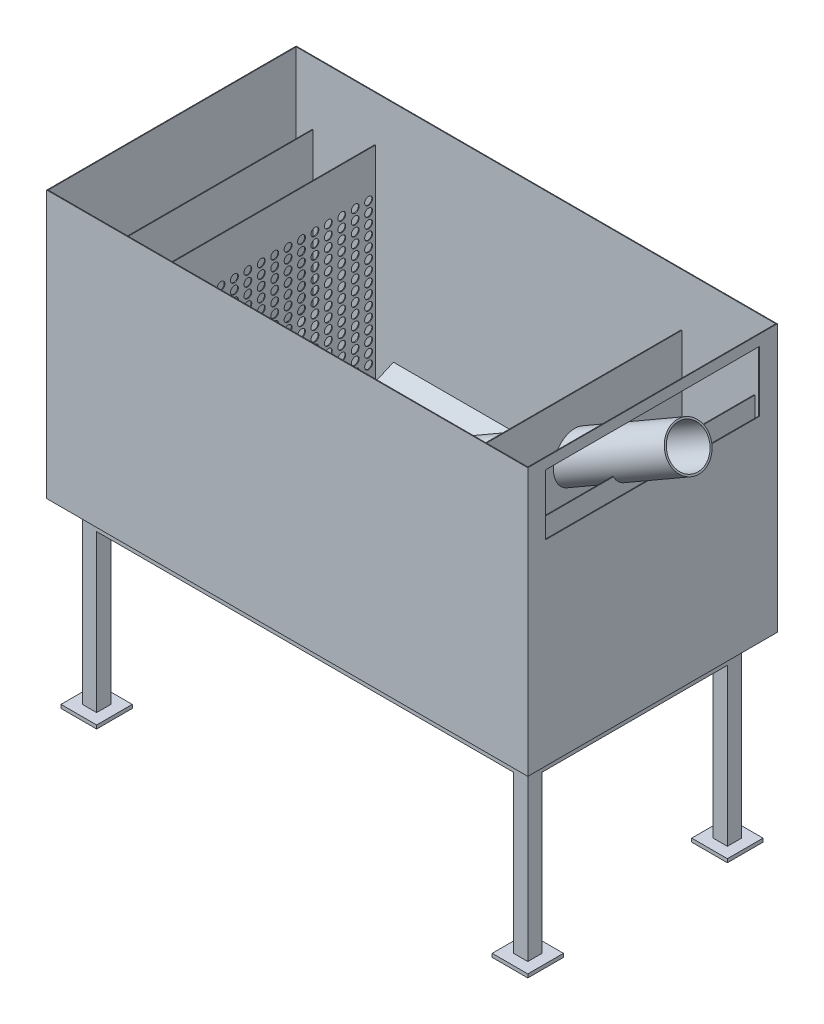
from build123d import *

# Parameters (mm, degrees)
MASTER_FOOTPRINT_W                    = 1350
MASTER_FOOTPRINT_H                    = 700
BATH_BASE_PLATE_DEPTH                 = 750
BATH_SHELL_2MM_T                      = -2
SKETCH_1_R                            = 50
INLET_D100_OPENING_DEPTH              = 10
INLET_IMPACT_BAFFLE_START             = 125
SKETCH_2_W                            = 540
SKETCH_2_H                            = 430
INLET_IMPACT_BAFFLE_DEPTH             = 2
DISTRIBUTOR_D22_START                 = 250
SKETCH_3_W                            = 640
SKETCH_3_H                            = 648
SKETCH_3_R                            = 11
DISTRIBUTOR_D22_DEPTH                 = 2
OUTLET_SUBMERGED_BAFFLE_START         = 1130
SKETCH_4_W                            = 600
SKETCH_4_H                            = 330
OUTLET_SUBMERGED_BAFFLE_DEPTH         = 2
OVERFLOW_WEIR_Z550_START              = 1290
SKETCH_5_W                            = 690
SKETCH_5_H                            = 548
OVERFLOW_WEIR_Z550_DEPTH              = 2
OUTLET_WEIR_SLOT_W600_START           = 1345
SKETCH_6_W                            = 600
SKETCH_6_H                            = 170
OUTLET_WEIR_SLOT_W600_DEPTH           = 10
SLOPED_SEDIMENT_FLOOR_START           = 275
SLOPED_SEDIMENT_FLOOR_DEPTH           = 825
SKETCH_8_W                            = 40
SKETCH_8_H                            = 40
FRAME_LEGS_40X40_H500_DEPTH           = 500
FRAME_LONGITUDINAL_RAILS_START        = -20
SKETCH_9_W                            = 1250
SKETCH_9_H                            = 40
FRAME_LONGITUDINAL_RAILS_DEPTH        = 40
FRAME_TRANSVERSE_RAILS_START          = -20
SKETCH_10_W                           = 40
SKETCH_10_H                           = 520
FRAME_TRANSVERSE_RAILS_DEPTH          = 40
FRAME_FOOT_PADS_100X100_START         = -500
SKETCH_11_W                           = 100
SKETCH_11_H                           = 100
FRAME_FOOT_PADS_100X100_DEPTH         = 10
SEALED_SCREW_PASSAGE_D120_PROFILE_R   = 60
SCREW_CASING_THIN_D110_T5_PROFILE_R   = 60
SCREW_CASING_THIN_D110_T5_PROFILE_R_2 = 55


with BuildPart() as part:
    # MASTER_FOOTPRINT → BATH_BASE_PLATE (new body)
    with BuildSketch(Plane(origin=(0, 0, 0), x_dir=(1, 0, 0), z_dir=(0, 1, 0))):
        with Locations((675, 350)):
            Rectangle(MASTER_FOOTPRINT_W, MASTER_FOOTPRINT_H)
    extrude(amount=BATH_BASE_PLATE_DEPTH)

    # BATH_SHELL_2MM
    bath_shell_2mm_openings = [part.faces().sort_by_distance(p)[0] for p in [
        (675, 750, -350),
    ]]
    offset(amount=BATH_SHELL_2MM_T, openings=bath_shell_2mm_openings, kind=Kind.INTERSECTION)

    # Эскиз1 → INLET_D100_OPENING (cut)
    with BuildSketch(Plane(origin=(0, 0, 0), x_dir=(0, 0, -1), z_dir=(1, 0, 0))):
        with Locations((350, 420)):
            Circle(SKETCH_1_R)
    extrude(amount=INLET_D100_OPENING_DEPTH, mode=Mode.SUBTRACT)

    # Эскиз6 → OUTLET_WEIR_SLOT_W600 (cut)
    with BuildSketch(Plane(origin=(0, 0, 0), x_dir=(0, 0, -1), z_dir=(1, 0, 0)).offset(OUTLET_WEIR_SLOT_W600_START)):
        with Locations((350, 635)):
            Rectangle(SKETCH_6_W, SKETCH_6_H)
    extrude(amount=OUTLET_WEIR_SLOT_W600_DEPTH, mode=Mode.SUBTRACT)

    # Эскиз7 → SLOPED_SEDIMENT_FLOOR (add)
    with BuildSketch(Plane(origin=(0, 0, 0), x_dir=(0, 0, -1), z_dir=(1, 0, 0)).offset(SLOPED_SEDIMENT_FLOOR_START)):
        Polygon((2, -1), (2, 120), (280, -1), align=None)
        Polygon((698, -1), (698, 120), (420, -1), align=None)
    extrude(amount=SLOPED_SEDIMENT_FLOOR_DEPTH)

    # Эскиз8 → FRAME_LEGS_40X40_H500 (add)
    with BuildSketch(Plane(origin=(0, 0, 0), x_dir=(1, 0, 0), z_dir=(0, 1, 0))):
        with Locations((70, 70)):
            Rectangle(SKETCH_8_W, SKETCH_8_H)
        with Locations((70, 630)):
            Rectangle(SKETCH_8_W, SKETCH_8_H)
        with Locations((1280, 70)):
            Rectangle(SKETCH_8_W, SKETCH_8_H)
        with Locations((1280, 630)):
            Rectangle(SKETCH_8_W, SKETCH_8_H)
    extrude(amount=-FRAME_LEGS_40X40_H500_DEPTH)

    # Эскиз9 → FRAME_LONGITUDINAL_RAILS (add)
    with BuildSketch(Plane(origin=(0, 0, 0), x_dir=(1, 0, 0), z_dir=(0, 1, 0)).offset(FRAME_LONGITUDINAL_RAILS_START)):
        with Locations((675, 70)):
            Rectangle(SKETCH_9_W, SKETCH_9_H)
        with Locations((675, 630)):
            Rectangle(SKETCH_9_W, SKETCH_9_H)
    extrude(amount=-FRAME_LONGITUDINAL_RAILS_DEPTH)

    # Эскиз10 → FRAME_TRANSVERSE_RAILS (add)
    with BuildSketch(Plane(origin=(0, 0, 0), x_dir=(1, 0, 0), z_dir=(0, 1, 0)).offset(FRAME_TRANSVERSE_RAILS_START)):
        with Locations((70, 350)):
            Rectangle(SKETCH_10_W, SKETCH_10_H)
        with Locations((1280, 350)):
            Rectangle(SKETCH_10_W, SKETCH_10_H)
    extrude(amount=-FRAME_TRANSVERSE_RAILS_DEPTH)

    # Эскиз11 → FRAME_FOOT_PADS_100X100 (add)
    with BuildSketch(Plane(origin=(0, 0, 0), x_dir=(1, 0, 0), z_dir=(0, 1, 0)).offset(FRAME_FOOT_PADS_100X100_START)):
        with Locations((70, 70)):
            Rectangle(SKETCH_11_W, SKETCH_11_H)
        with Locations((70, 630)):
            Rectangle(SKETCH_11_W, SKETCH_11_H)
        with Locations((1280, 70)):
            Rectangle(SKETCH_11_W, SKETCH_11_H)
        with Locations((1280, 630)):
            Rectangle(SKETCH_11_W, SKETCH_11_H)
    extrude(amount=-FRAME_FOOT_PADS_100X100_DEPTH)


with BuildPart() as body_2:
    # Эскиз2 → INLET_IMPACT_BAFFLE (new body)
    with BuildSketch(Plane(origin=(0, 0, 0), x_dir=(0, 0, -1), z_dir=(1, 0, 0)).offset(INLET_IMPACT_BAFFLE_START)):
        with Locations((350, 435)):
            Rectangle(SKETCH_2_W, SKETCH_2_H)
    extrude(amount=INLET_IMPACT_BAFFLE_DEPTH)


with BuildPart() as body_3:
    # Эскиз3 → DISTRIBUTOR_D22 (new body)
    with BuildSketch(Plane(origin=(0, 0, 0), x_dir=(0, 0, -1), z_dir=(1, 0, 0)).offset(DISTRIBUTOR_D22_START)):
        with Locations((350, 326)):
            Rectangle(SKETCH_3_W, SKETCH_3_H)
        with Locations((48.823529412, 125)):
            Circle(SKETCH_3_R, mode=Mode.SUBTRACT)
        with Locations((48.823529412, 153.5)):
            Circle(SKETCH_3_R, mode=Mode.SUBTRACT)
        with Locations((48.823529412, 182)):
            Circle(SKETCH_3_R, mode=Mode.SUBTRACT)
        with Locations((48.823529412, 210.5)):
            Circle(SKETCH_3_R, mode=Mode.SUBTRACT)
        with Locations((48.823529412, 239)):
            Circle(SKETCH_3_R, mode=Mode.SUBTRACT)
        with Locations((48.823529412, 267.5)):
            Circle(SKETCH_3_R, mode=Mode.SUBTRACT)
        with Locations((48.823529412, 296)):
            Circle(SKETCH_3_R, mode=Mode.SUBTRACT)
        with Locations((48.823529412, 324.5)):
            Circle(SKETCH_3_R, mode=Mode.SUBTRACT)
        with Locations((48.823529412, 353)):
            Circle(SKETCH_3_R, mode=Mode.SUBTRACT)
        with Locations((48.823529412, 381.5)):
            Circle(SKETCH_3_R, mode=Mode.SUBTRACT)
        with Locations((48.823529412, 410)):
            Circle(SKETCH_3_R, mode=Mode.SUBTRACT)
        with Locations((48.823529412, 438.5)):
            Circle(SKETCH_3_R, mode=Mode.SUBTRACT)
        with Locations((48.823529412, 467)):
            Circle(SKETCH_3_R, mode=Mode.SUBTRACT)
        with Locations((48.823529412, 495.5)):
            Circle(SKETCH_3_R, mode=Mode.SUBTRACT)
        with Locations((48.823529412, 524)):
            Circle(SKETCH_3_R, mode=Mode.SUBTRACT)
        with Locations((86.470588235, 125)):
            Circle(SKETCH_3_R, mode=Mode.SUBTRACT)
        with Locations((86.470588235, 153.5)):
            Circle(SKETCH_3_R, mode=Mode.SUBTRACT)
        with Locations((86.470588235, 182)):
            Circle(SKETCH_3_R, mode=Mode.SUBTRACT)
        with Locations((86.470588235, 210.5)):
            Circle(SKETCH_3_R, mode=Mode.SUBTRACT)
        with Locations((86.470588235, 239)):
            Circle(SKETCH_3_R, mode=Mode.SUBTRACT)
        with Locations((86.470588235, 267.5)):
            Circle(SKETCH_3_R, mode=Mode.SUBTRACT)
        with Locations((86.470588235, 296)):
            Circle(SKETCH_3_R, mode=Mode.SUBTRACT)
        with Locations((86.470588235, 324.5)):
            Circle(SKETCH_3_R, mode=Mode.SUBTRACT)
        with Locations((86.470588235, 353)):
            Circle(SKETCH_3_R, mode=Mode.SUBTRACT)
        with Locations((86.470588235, 381.5)):
            Circle(SKETCH_3_R, mode=Mode.SUBTRACT)
        with Locations((86.470588235, 410)):
            Circle(SKETCH_3_R, mode=Mode.SUBTRACT)
        with Locations((86.470588235, 438.5)):
            Circle(SKETCH_3_R, mode=Mode.SUBTRACT)
        with Locations((86.470588235, 467)):
            Circle(SKETCH_3_R, mode=Mode.SUBTRACT)
        with Locations((86.470588235, 495.5)):
            Circle(SKETCH_3_R, mode=Mode.SUBTRACT)
        with Locations((86.470588235, 524)):
            Circle(SKETCH_3_R, mode=Mode.SUBTRACT)
        with Locations((124.117647059, 125)):
            Circle(SKETCH_3_R, mode=Mode.SUBTRACT)
        with Locations((124.117647059, 153.5)):
            Circle(SKETCH_3_R, mode=Mode.SUBTRACT)
        with Locations((124.117647059, 182)):
            Circle(SKETCH_3_R, mode=Mode.SUBTRACT)
        with Locations((124.117647059, 210.5)):
            Circle(SKETCH_3_R, mode=Mode.SUBTRACT)
        with Locations((124.117647059, 239)):
            Circle(SKETCH_3_R, mode=Mode.SUBTRACT)
        with Locations((124.117647059, 267.5)):
            Circle(SKETCH_3_R, mode=Mode.SUBTRACT)
        with Locations((124.117647059, 296)):
            Circle(SKETCH_3_R, mode=Mode.SUBTRACT)
        with Locations((124.117647059, 324.5)):
            Circle(SKETCH_3_R, mode=Mode.SUBTRACT)
        with Locations((124.117647059, 353)):
            Circle(SKETCH_3_R, mode=Mode.SUBTRACT)
        with Locations((124.117647059, 381.5)):
            Circle(SKETCH_3_R, mode=Mode.SUBTRACT)
        with Locations((124.117647059, 410)):
            Circle(SKETCH_3_R, mode=Mode.SUBTRACT)
        with Locations((124.117647059, 438.5)):
            Circle(SKETCH_3_R, mode=Mode.SUBTRACT)
        with Locations((124.117647059, 467)):
            Circle(SKETCH_3_R, mode=Mode.SUBTRACT)
        with Locations((124.117647059, 495.5)):
            Circle(SKETCH_3_R, mode=Mode.SUBTRACT)
        with Locations((124.117647059, 524)):
            Circle(SKETCH_3_R, mode=Mode.SUBTRACT)
        with Locations((161.764705882, 125)):
            Circle(SKETCH_3_R, mode=Mode.SUBTRACT)
        with Locations((161.764705882, 153.5)):
            Circle(SKETCH_3_R, mode=Mode.SUBTRACT)
        with Locations((161.764705882, 182)):
            Circle(SKETCH_3_R, mode=Mode.SUBTRACT)
        with Locations((161.764705882, 210.5)):
            Circle(SKETCH_3_R, mode=Mode.SUBTRACT)
        with Locations((161.764705882, 239)):
            Circle(SKETCH_3_R, mode=Mode.SUBTRACT)
        with Locations((161.764705882, 267.5)):
            Circle(SKETCH_3_R, mode=Mode.SUBTRACT)
        with Locations((161.764705882, 296)):
            Circle(SKETCH_3_R, mode=Mode.SUBTRACT)
        with Locations((161.764705882, 324.5)):
            Circle(SKETCH_3_R, mode=Mode.SUBTRACT)
        with Locations((161.764705882, 353)):
            Circle(SKETCH_3_R, mode=Mode.SUBTRACT)
        with Locations((161.764705882, 381.5)):
            Circle(SKETCH_3_R, mode=Mode.SUBTRACT)
        with Locations((161.764705882, 410)):
            Circle(SKETCH_3_R, mode=Mode.SUBTRACT)
        with Locations((161.764705882, 438.5)):
            Circle(SKETCH_3_R, mode=Mode.SUBTRACT)
        with Locations((161.764705882, 467)):
            Circle(SKETCH_3_R, mode=Mode.SUBTRACT)
        with Locations((161.764705882, 495.5)):
            Circle(SKETCH_3_R, mode=Mode.SUBTRACT)
        with Locations((161.764705882, 524)):
            Circle(SKETCH_3_R, mode=Mode.SUBTRACT)
        with Locations((199.411764706, 125)):
            Circle(SKETCH_3_R, mode=Mode.SUBTRACT)
        with Locations((199.411764706, 153.5)):
            Circle(SKETCH_3_R, mode=Mode.SUBTRACT)
        with Locations((199.411764706, 182)):
            Circle(SKETCH_3_R, mode=Mode.SUBTRACT)
        with Locations((199.411764706, 210.5)):
            Circle(SKETCH_3_R, mode=Mode.SUBTRACT)
        with Locations((199.411764706, 239)):
            Circle(SKETCH_3_R, mode=Mode.SUBTRACT)
        with Locations((199.411764706, 267.5)):
            Circle(SKETCH_3_R, mode=Mode.SUBTRACT)
        with Locations((199.411764706, 296)):
            Circle(SKETCH_3_R, mode=Mode.SUBTRACT)
        with Locations((199.411764706, 324.5)):
            Circle(SKETCH_3_R, mode=Mode.SUBTRACT)
        with Locations((199.411764706, 353)):
            Circle(SKETCH_3_R, mode=Mode.SUBTRACT)
        with Locations((199.411764706, 381.5)):
            Circle(SKETCH_3_R, mode=Mode.SUBTRACT)
        with Locations((199.411764706, 410)):
            Circle(SKETCH_3_R, mode=Mode.SUBTRACT)
        with Locations((199.411764706, 438.5)):
            Circle(SKETCH_3_R, mode=Mode.SUBTRACT)
        with Locations((199.411764706, 467)):
            Circle(SKETCH_3_R, mode=Mode.SUBTRACT)
        with Locations((199.411764706, 495.5)):
            Circle(SKETCH_3_R, mode=Mode.SUBTRACT)
        with Locations((199.411764706, 524)):
            Circle(SKETCH_3_R, mode=Mode.SUBTRACT)
        with Locations((237.058823529, 125)):
            Circle(SKETCH_3_R, mode=Mode.SUBTRACT)
        with Locations((237.058823529, 153.5)):
            Circle(SKETCH_3_R, mode=Mode.SUBTRACT)
        with Locations((237.058823529, 182)):
            Circle(SKETCH_3_R, mode=Mode.SUBTRACT)
        with Locations((237.058823529, 210.5)):
            Circle(SKETCH_3_R, mode=Mode.SUBTRACT)
        with Locations((237.058823529, 239)):
            Circle(SKETCH_3_R, mode=Mode.SUBTRACT)
        with Locations((237.058823529, 267.5)):
            Circle(SKETCH_3_R, mode=Mode.SUBTRACT)
        with Locations((237.058823529, 296)):
            Circle(SKETCH_3_R, mode=Mode.SUBTRACT)
        with Locations((237.058823529, 324.5)):
            Circle(SKETCH_3_R, mode=Mode.SUBTRACT)
        with Locations((237.058823529, 353)):
            Circle(SKETCH_3_R, mode=Mode.SUBTRACT)
        with Locations((237.058823529, 381.5)):
            Circle(SKETCH_3_R, mode=Mode.SUBTRACT)
        with Locations((237.058823529, 410)):
            Circle(SKETCH_3_R, mode=Mode.SUBTRACT)
        with Locations((237.058823529, 438.5)):
            Circle(SKETCH_3_R, mode=Mode.SUBTRACT)
        with Locations((237.058823529, 467)):
            Circle(SKETCH_3_R, mode=Mode.SUBTRACT)
        with Locations((237.058823529, 495.5)):
            Circle(SKETCH_3_R, mode=Mode.SUBTRACT)
        with Locations((237.058823529, 524)):
            Circle(SKETCH_3_R, mode=Mode.SUBTRACT)
        with Locations((274.705882353, 125)):
            Circle(SKETCH_3_R, mode=Mode.SUBTRACT)
        with Locations((274.705882353, 153.5)):
            Circle(SKETCH_3_R, mode=Mode.SUBTRACT)
        with Locations((274.705882353, 182)):
            Circle(SKETCH_3_R, mode=Mode.SUBTRACT)
        with Locations((274.705882353, 210.5)):
            Circle(SKETCH_3_R, mode=Mode.SUBTRACT)
        with Locations((274.705882353, 239)):
            Circle(SKETCH_3_R, mode=Mode.SUBTRACT)
        with Locations((274.705882353, 267.5)):
            Circle(SKETCH_3_R, mode=Mode.SUBTRACT)
        with Locations((274.705882353, 296)):
            Circle(SKETCH_3_R, mode=Mode.SUBTRACT)
        with Locations((274.705882353, 324.5)):
            Circle(SKETCH_3_R, mode=Mode.SUBTRACT)
        with Locations((274.705882353, 353)):
            Circle(SKETCH_3_R, mode=Mode.SUBTRACT)
        with Locations((274.705882353, 381.5)):
            Circle(SKETCH_3_R, mode=Mode.SUBTRACT)
        with Locations((274.705882353, 410)):
            Circle(SKETCH_3_R, mode=Mode.SUBTRACT)
        with Locations((274.705882353, 438.5)):
            Circle(SKETCH_3_R, mode=Mode.SUBTRACT)
        with Locations((274.705882353, 467)):
            Circle(SKETCH_3_R, mode=Mode.SUBTRACT)
        with Locations((274.705882353, 495.5)):
            Circle(SKETCH_3_R, mode=Mode.SUBTRACT)
        with Locations((274.705882353, 524)):
            Circle(SKETCH_3_R, mode=Mode.SUBTRACT)
        with Locations((312.352941176, 125)):
            Circle(SKETCH_3_R, mode=Mode.SUBTRACT)
        with Locations((312.352941176, 153.5)):
            Circle(SKETCH_3_R, mode=Mode.SUBTRACT)
        with Locations((312.352941176, 182)):
            Circle(SKETCH_3_R, mode=Mode.SUBTRACT)
        with Locations((312.352941176, 210.5)):
            Circle(SKETCH_3_R, mode=Mode.SUBTRACT)
        with Locations((312.352941176, 239)):
            Circle(SKETCH_3_R, mode=Mode.SUBTRACT)
        with Locations((312.352941176, 267.5)):
            Circle(SKETCH_3_R, mode=Mode.SUBTRACT)
        with Locations((312.352941176, 296)):
            Circle(SKETCH_3_R, mode=Mode.SUBTRACT)
        with Locations((312.352941176, 324.5)):
            Circle(SKETCH_3_R, mode=Mode.SUBTRACT)
        with Locations((312.352941176, 353)):
            Circle(SKETCH_3_R, mode=Mode.SUBTRACT)
        with Locations((312.352941176, 381.5)):
            Circle(SKETCH_3_R, mode=Mode.SUBTRACT)
        with Locations((312.352941176, 410)):
            Circle(SKETCH_3_R, mode=Mode.SUBTRACT)
        with Locations((312.352941176, 438.5)):
            Circle(SKETCH_3_R, mode=Mode.SUBTRACT)
        with Locations((312.352941176, 467)):
            Circle(SKETCH_3_R, mode=Mode.SUBTRACT)
        with Locations((312.352941176, 495.5)):
            Circle(SKETCH_3_R, mode=Mode.SUBTRACT)
        with Locations((312.352941176, 524)):
            Circle(SKETCH_3_R, mode=Mode.SUBTRACT)
        with Locations((350, 125)):
            Circle(SKETCH_3_R, mode=Mode.SUBTRACT)
        with Locations((350, 153.5)):
            Circle(SKETCH_3_R, mode=Mode.SUBTRACT)
        with Locations((350, 182)):
            Circle(SKETCH_3_R, mode=Mode.SUBTRACT)
        with Locations((350, 210.5)):
            Circle(SKETCH_3_R, mode=Mode.SUBTRACT)
        with Locations((350, 239)):
            Circle(SKETCH_3_R, mode=Mode.SUBTRACT)
        with Locations((350, 267.5)):
            Circle(SKETCH_3_R, mode=Mode.SUBTRACT)
        with Locations((350, 296)):
            Circle(SKETCH_3_R, mode=Mode.SUBTRACT)
        with Locations((350, 324.5)):
            Circle(SKETCH_3_R, mode=Mode.SUBTRACT)
        with Locations((350, 353)):
            Circle(SKETCH_3_R, mode=Mode.SUBTRACT)
        with Locations((350, 381.5)):
            Circle(SKETCH_3_R, mode=Mode.SUBTRACT)
        with Locations((350, 410)):
            Circle(SKETCH_3_R, mode=Mode.SUBTRACT)
        with Locations((350, 438.5)):
            Circle(SKETCH_3_R, mode=Mode.SUBTRACT)
        with Locations((350, 467)):
            Circle(SKETCH_3_R, mode=Mode.SUBTRACT)
        with Locations((350, 495.5)):
            Circle(SKETCH_3_R, mode=Mode.SUBTRACT)
        with Locations((350, 524)):
            Circle(SKETCH_3_R, mode=Mode.SUBTRACT)
        with Locations((387.647058824, 125)):
            Circle(SKETCH_3_R, mode=Mode.SUBTRACT)
        with Locations((387.647058824, 153.5)):
            Circle(SKETCH_3_R, mode=Mode.SUBTRACT)
        with Locations((387.647058824, 182)):
            Circle(SKETCH_3_R, mode=Mode.SUBTRACT)
        with Locations((387.647058824, 210.5)):
            Circle(SKETCH_3_R, mode=Mode.SUBTRACT)
        with Locations((387.647058824, 239)):
            Circle(SKETCH_3_R, mode=Mode.SUBTRACT)
        with Locations((387.647058824, 267.5)):
            Circle(SKETCH_3_R, mode=Mode.SUBTRACT)
        with Locations((387.647058824, 296)):
            Circle(SKETCH_3_R, mode=Mode.SUBTRACT)
        with Locations((387.647058824, 324.5)):
            Circle(SKETCH_3_R, mode=Mode.SUBTRACT)
        with Locations((387.647058824, 353)):
            Circle(SKETCH_3_R, mode=Mode.SUBTRACT)
        with Locations((387.647058824, 381.5)):
            Circle(SKETCH_3_R, mode=Mode.SUBTRACT)
        with Locations((387.647058824, 410)):
            Circle(SKETCH_3_R, mode=Mode.SUBTRACT)
        with Locations((387.647058824, 438.5)):
            Circle(SKETCH_3_R, mode=Mode.SUBTRACT)
        with Locations((387.647058824, 467)):
            Circle(SKETCH_3_R, mode=Mode.SUBTRACT)
        with Locations((387.647058824, 495.5)):
            Circle(SKETCH_3_R, mode=Mode.SUBTRACT)
        with Locations((387.647058824, 524)):
            Circle(SKETCH_3_R, mode=Mode.SUBTRACT)
        with Locations((425.294117647, 125)):
            Circle(SKETCH_3_R, mode=Mode.SUBTRACT)
        with Locations((425.294117647, 153.5)):
            Circle(SKETCH_3_R, mode=Mode.SUBTRACT)
        with Locations((425.294117647, 182)):
            Circle(SKETCH_3_R, mode=Mode.SUBTRACT)
        with Locations((425.294117647, 210.5)):
            Circle(SKETCH_3_R, mode=Mode.SUBTRACT)
        with Locations((425.294117647, 239)):
            Circle(SKETCH_3_R, mode=Mode.SUBTRACT)
        with Locations((425.294117647, 267.5)):
            Circle(SKETCH_3_R, mode=Mode.SUBTRACT)
        with Locations((425.294117647, 296)):
            Circle(SKETCH_3_R, mode=Mode.SUBTRACT)
        with Locations((425.294117647, 324.5)):
            Circle(SKETCH_3_R, mode=Mode.SUBTRACT)
        with Locations((425.294117647, 353)):
            Circle(SKETCH_3_R, mode=Mode.SUBTRACT)
        with Locations((425.294117647, 381.5)):
            Circle(SKETCH_3_R, mode=Mode.SUBTRACT)
        with Locations((425.294117647, 410)):
            Circle(SKETCH_3_R, mode=Mode.SUBTRACT)
        with Locations((425.294117647, 438.5)):
            Circle(SKETCH_3_R, mode=Mode.SUBTRACT)
        with Locations((425.294117647, 467)):
            Circle(SKETCH_3_R, mode=Mode.SUBTRACT)
        with Locations((425.294117647, 495.5)):
            Circle(SKETCH_3_R, mode=Mode.SUBTRACT)
        with Locations((425.294117647, 524)):
            Circle(SKETCH_3_R, mode=Mode.SUBTRACT)
        with Locations((462.941176471, 125)):
            Circle(SKETCH_3_R, mode=Mode.SUBTRACT)
        with Locations((462.941176471, 153.5)):
            Circle(SKETCH_3_R, mode=Mode.SUBTRACT)
        with Locations((462.941176471, 182)):
            Circle(SKETCH_3_R, mode=Mode.SUBTRACT)
        with Locations((462.941176471, 210.5)):
            Circle(SKETCH_3_R, mode=Mode.SUBTRACT)
        with Locations((462.941176471, 239)):
            Circle(SKETCH_3_R, mode=Mode.SUBTRACT)
        with Locations((462.941176471, 267.5)):
            Circle(SKETCH_3_R, mode=Mode.SUBTRACT)
        with Locations((462.941176471, 296)):
            Circle(SKETCH_3_R, mode=Mode.SUBTRACT)
        with Locations((462.941176471, 324.5)):
            Circle(SKETCH_3_R, mode=Mode.SUBTRACT)
        with Locations((462.941176471, 353)):
            Circle(SKETCH_3_R, mode=Mode.SUBTRACT)
        with Locations((462.941176471, 381.5)):
            Circle(SKETCH_3_R, mode=Mode.SUBTRACT)
        with Locations((462.941176471, 410)):
            Circle(SKETCH_3_R, mode=Mode.SUBTRACT)
        with Locations((462.941176471, 438.5)):
            Circle(SKETCH_3_R, mode=Mode.SUBTRACT)
        with Locations((462.941176471, 467)):
            Circle(SKETCH_3_R, mode=Mode.SUBTRACT)
        with Locations((462.941176471, 495.5)):
            Circle(SKETCH_3_R, mode=Mode.SUBTRACT)
        with Locations((462.941176471, 524)):
            Circle(SKETCH_3_R, mode=Mode.SUBTRACT)
        with Locations((500.588235294, 125)):
            Circle(SKETCH_3_R, mode=Mode.SUBTRACT)
        with Locations((500.588235294, 153.5)):
            Circle(SKETCH_3_R, mode=Mode.SUBTRACT)
        with Locations((500.588235294, 182)):
            Circle(SKETCH_3_R, mode=Mode.SUBTRACT)
        with Locations((500.588235294, 210.5)):
            Circle(SKETCH_3_R, mode=Mode.SUBTRACT)
        with Locations((500.588235294, 239)):
            Circle(SKETCH_3_R, mode=Mode.SUBTRACT)
        with Locations((500.588235294, 267.5)):
            Circle(SKETCH_3_R, mode=Mode.SUBTRACT)
        with Locations((500.588235294, 296)):
            Circle(SKETCH_3_R, mode=Mode.SUBTRACT)
        with Locations((500.588235294, 324.5)):
            Circle(SKETCH_3_R, mode=Mode.SUBTRACT)
        with Locations((500.588235294, 353)):
            Circle(SKETCH_3_R, mode=Mode.SUBTRACT)
        with Locations((500.588235294, 381.5)):
            Circle(SKETCH_3_R, mode=Mode.SUBTRACT)
        with Locations((500.588235294, 410)):
            Circle(SKETCH_3_R, mode=Mode.SUBTRACT)
        with Locations((500.588235294, 438.5)):
            Circle(SKETCH_3_R, mode=Mode.SUBTRACT)
        with Locations((500.588235294, 467)):
            Circle(SKETCH_3_R, mode=Mode.SUBTRACT)
        with Locations((500.588235294, 495.5)):
            Circle(SKETCH_3_R, mode=Mode.SUBTRACT)
        with Locations((500.588235294, 524)):
            Circle(SKETCH_3_R, mode=Mode.SUBTRACT)
        with Locations((538.235294118, 125)):
            Circle(SKETCH_3_R, mode=Mode.SUBTRACT)
        with Locations((538.235294118, 153.5)):
            Circle(SKETCH_3_R, mode=Mode.SUBTRACT)
        with Locations((538.235294118, 182)):
            Circle(SKETCH_3_R, mode=Mode.SUBTRACT)
        with Locations((538.235294118, 210.5)):
            Circle(SKETCH_3_R, mode=Mode.SUBTRACT)
        with Locations((538.235294118, 239)):
            Circle(SKETCH_3_R, mode=Mode.SUBTRACT)
        with Locations((538.235294118, 267.5)):
            Circle(SKETCH_3_R, mode=Mode.SUBTRACT)
        with Locations((538.235294118, 296)):
            Circle(SKETCH_3_R, mode=Mode.SUBTRACT)
        with Locations((538.235294118, 324.5)):
            Circle(SKETCH_3_R, mode=Mode.SUBTRACT)
        with Locations((538.235294118, 353)):
            Circle(SKETCH_3_R, mode=Mode.SUBTRACT)
        with Locations((538.235294118, 381.5)):
            Circle(SKETCH_3_R, mode=Mode.SUBTRACT)
        with Locations((538.235294118, 410)):
            Circle(SKETCH_3_R, mode=Mode.SUBTRACT)
        with Locations((538.235294118, 438.5)):
            Circle(SKETCH_3_R, mode=Mode.SUBTRACT)
        with Locations((538.235294118, 467)):
            Circle(SKETCH_3_R, mode=Mode.SUBTRACT)
        with Locations((538.235294118, 495.5)):
            Circle(SKETCH_3_R, mode=Mode.SUBTRACT)
        with Locations((538.235294118, 524)):
            Circle(SKETCH_3_R, mode=Mode.SUBTRACT)
        with Locations((575.882352941, 125)):
            Circle(SKETCH_3_R, mode=Mode.SUBTRACT)
        with Locations((575.882352941, 153.5)):
            Circle(SKETCH_3_R, mode=Mode.SUBTRACT)
        with Locations((575.882352941, 182)):
            Circle(SKETCH_3_R, mode=Mode.SUBTRACT)
        with Locations((575.882352941, 210.5)):
            Circle(SKETCH_3_R, mode=Mode.SUBTRACT)
        with Locations((575.882352941, 239)):
            Circle(SKETCH_3_R, mode=Mode.SUBTRACT)
        with Locations((575.882352941, 267.5)):
            Circle(SKETCH_3_R, mode=Mode.SUBTRACT)
        with Locations((575.882352941, 296)):
            Circle(SKETCH_3_R, mode=Mode.SUBTRACT)
        with Locations((575.882352941, 324.5)):
            Circle(SKETCH_3_R, mode=Mode.SUBTRACT)
        with Locations((575.882352941, 353)):
            Circle(SKETCH_3_R, mode=Mode.SUBTRACT)
        with Locations((575.882352941, 381.5)):
            Circle(SKETCH_3_R, mode=Mode.SUBTRACT)
        with Locations((575.882352941, 410)):
            Circle(SKETCH_3_R, mode=Mode.SUBTRACT)
        with Locations((575.882352941, 438.5)):
            Circle(SKETCH_3_R, mode=Mode.SUBTRACT)
        with Locations((575.882352941, 467)):
            Circle(SKETCH_3_R, mode=Mode.SUBTRACT)
        with Locations((575.882352941, 495.5)):
            Circle(SKETCH_3_R, mode=Mode.SUBTRACT)
        with Locations((575.882352941, 524)):
            Circle(SKETCH_3_R, mode=Mode.SUBTRACT)
        with Locations((613.529411765, 125)):
            Circle(SKETCH_3_R, mode=Mode.SUBTRACT)
        with Locations((613.529411765, 153.5)):
            Circle(SKETCH_3_R, mode=Mode.SUBTRACT)
        with Locations((613.529411765, 182)):
            Circle(SKETCH_3_R, mode=Mode.SUBTRACT)
        with Locations((613.529411765, 210.5)):
            Circle(SKETCH_3_R, mode=Mode.SUBTRACT)
        with Locations((613.529411765, 239)):
            Circle(SKETCH_3_R, mode=Mode.SUBTRACT)
        with Locations((613.529411765, 267.5)):
            Circle(SKETCH_3_R, mode=Mode.SUBTRACT)
        with Locations((613.529411765, 296)):
            Circle(SKETCH_3_R, mode=Mode.SUBTRACT)
        with Locations((613.529411765, 324.5)):
            Circle(SKETCH_3_R, mode=Mode.SUBTRACT)
        with Locations((613.529411765, 353)):
            Circle(SKETCH_3_R, mode=Mode.SUBTRACT)
        with Locations((613.529411765, 381.5)):
            Circle(SKETCH_3_R, mode=Mode.SUBTRACT)
        with Locations((613.529411765, 410)):
            Circle(SKETCH_3_R, mode=Mode.SUBTRACT)
        with Locations((613.529411765, 438.5)):
            Circle(SKETCH_3_R, mode=Mode.SUBTRACT)
        with Locations((613.529411765, 467)):
            Circle(SKETCH_3_R, mode=Mode.SUBTRACT)
        with Locations((613.529411765, 495.5)):
            Circle(SKETCH_3_R, mode=Mode.SUBTRACT)
        with Locations((613.529411765, 524)):
            Circle(SKETCH_3_R, mode=Mode.SUBTRACT)
        with Locations((651.176470588, 125)):
            Circle(SKETCH_3_R, mode=Mode.SUBTRACT)
        with Locations((651.176470588, 153.5)):
            Circle(SKETCH_3_R, mode=Mode.SUBTRACT)
        with Locations((651.176470588, 182)):
            Circle(SKETCH_3_R, mode=Mode.SUBTRACT)
        with Locations((651.176470588, 210.5)):
            Circle(SKETCH_3_R, mode=Mode.SUBTRACT)
        with Locations((651.176470588, 239)):
            Circle(SKETCH_3_R, mode=Mode.SUBTRACT)
        with Locations((651.176470588, 267.5)):
            Circle(SKETCH_3_R, mode=Mode.SUBTRACT)
        with Locations((651.176470588, 296)):
            Circle(SKETCH_3_R, mode=Mode.SUBTRACT)
        with Locations((651.176470588, 324.5)):
            Circle(SKETCH_3_R, mode=Mode.SUBTRACT)
        with Locations((651.176470588, 353)):
            Circle(SKETCH_3_R, mode=Mode.SUBTRACT)
        with Locations((651.176470588, 381.5)):
            Circle(SKETCH_3_R, mode=Mode.SUBTRACT)
        with Locations((651.176470588, 410)):
            Circle(SKETCH_3_R, mode=Mode.SUBTRACT)
        with Locations((651.176470588, 438.5)):
            Circle(SKETCH_3_R, mode=Mode.SUBTRACT)
        with Locations((651.176470588, 467)):
            Circle(SKETCH_3_R, mode=Mode.SUBTRACT)
        with Locations((651.176470588, 495.5)):
            Circle(SKETCH_3_R, mode=Mode.SUBTRACT)
        with Locations((651.176470588, 524)):
            Circle(SKETCH_3_R, mode=Mode.SUBTRACT)
    extrude(amount=DISTRIBUTOR_D22_DEPTH)


with BuildPart() as body_4:
    # Эскиз4 → OUTLET_SUBMERGED_BAFFLE (new body)
    with BuildSketch(Plane(origin=(0, 0, 0), x_dir=(0, 0, -1), z_dir=(1, 0, 0)).offset(OUTLET_SUBMERGED_BAFFLE_START)):
        with Locations((350, 485)):
            Rectangle(SKETCH_4_W, SKETCH_4_H)
    extrude(amount=OUTLET_SUBMERGED_BAFFLE_DEPTH)


with BuildPart() as body_5:
    # Эскиз5 → OVERFLOW_WEIR_Z550 (new body)
    with BuildSketch(Plane(origin=(0, 0, 0), x_dir=(0, 0, -1), z_dir=(1, 0, 0)).offset(OVERFLOW_WEIR_Z550_START)):
        with Locations((350, 276)):
            Rectangle(SKETCH_5_W, SKETCH_5_H)
    extrude(amount=OVERFLOW_WEIR_Z550_DEPTH)


with BuildPart() as sealed_screw_passage_d120_tool:
    # SEALED_SCREW_PASSAGE_D120: sweep along a curve in space
    with BuildLine() as sealed_screw_passage_d120_path:
        Line((400, 70, -350), (1450, 676.217782649, -350))
    # SEALED_SCREW_PASSAGE_D120 profile (on start of the path) → SEALED_SCREW_PASSAGE_D120 (sweep)
    with BuildSketch(Plane(origin=(400, 70, -350), x_dir=(-0.5, 0.8660254037844387, 0), z_dir=(0.8660254037844387, 0.5, 0))):
        Circle(SEALED_SCREW_PASSAGE_D120_PROFILE_R)
    sweep(path=sealed_screw_passage_d120_path.line)


with BuildPart() as part_1:
    add(part.part)

    # SEALED_SCREW_PASSAGE_D120: cut by sealed_screw_passage_d120_tool
    add(sealed_screw_passage_d120_tool.part, mode=Mode.SUBTRACT)


with BuildPart() as body_4_1:
    add(body_4.part)

    # SEALED_SCREW_PASSAGE_D120: cut by sealed_screw_passage_d120_tool
    add(sealed_screw_passage_d120_tool.part, mode=Mode.SUBTRACT)


with BuildPart() as body_5_1:
    add(body_5.part)

    # SEALED_SCREW_PASSAGE_D120: cut by sealed_screw_passage_d120_tool
    add(sealed_screw_passage_d120_tool.part, mode=Mode.SUBTRACT)


with BuildPart() as body_6:
    # SCREW_CASING_THIN_D110_T5: sweep along a curve in space
    with BuildLine() as screw_casing_thin_d110_t5_path:
        Line((400, 70, -350), (1450, 676.217782649, -350))
    # SCREW_CASING_THIN_D110_T5 profile (on start of the path) → SCREW_CASING_THIN_D110_T5 (sweep)
    with BuildSketch(Plane(origin=(400, 70, -350), x_dir=(-0.5, 0.8660254037844387, 0), z_dir=(0.8660254037844387, 0.5, 0))):
        Circle(SCREW_CASING_THIN_D110_T5_PROFILE_R)
        Circle(SCREW_CASING_THIN_D110_T5_PROFILE_R_2, mode=Mode.SUBTRACT)
    sweep(path=screw_casing_thin_d110_t5_path.line)


solid = Compound([body_2.part, body_3.part, part_1.part, body_4_1.part, body_5_1.part, body_6.part])
